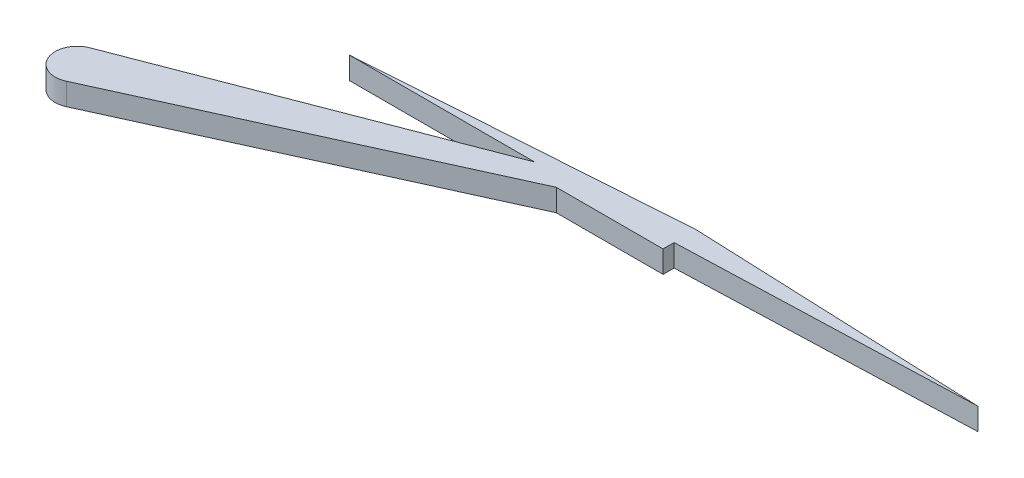
from build123d import *

# Parameters (mm, degrees)
BOSS_EXTRUDE1_DEPTH = 1
BOSS_EXTRUDE3_DEPTH = 1


with BuildPart() as part:
    # Sketch1 → Boss-Extrude1 (new body)
    with BuildSketch(Plane(origin=(0, 0, 0), x_dir=(1, 0, 0), z_dir=(0, 1, 0))):
        with BuildLine():
            Line((-0.358770303, 0.933425878), (15.280005831, 6.944324642))
            Line((15.280005831, 6.944324642), (20.500600983, 7.022426724))
            Line((20.500600983, 7.022426724), (20.500600983, 6.022426724))
            Line((20.500600983, 6.022426724), (15.666288625, 6.022426724))
            Line((15.666288625, 6.022426724), (0.413795285, -0.910369959))
            ThreePointArc((0.413795285, -0.910369959), (-0.922308359, -0.386454772), (-0.358770303, 0.933425878))
        make_face()
    extrude(amount=BOSS_EXTRUDE1_DEPTH)

    # Sketch3 → Boss-Extrude3 (add)
    with BuildSketch(Plane(origin=(0, 1, 0), x_dir=(1, 0, 0), z_dir=(0, 1, 0))):
        Polygon((20.500600983, 6.522426724), (5.79658702, 6.522426724), (20.500600983, 7.524744671), (33.79658702, 6.983375683), align=None)
    extrude(amount=-BOSS_EXTRUDE3_DEPTH)


solid = part.part
